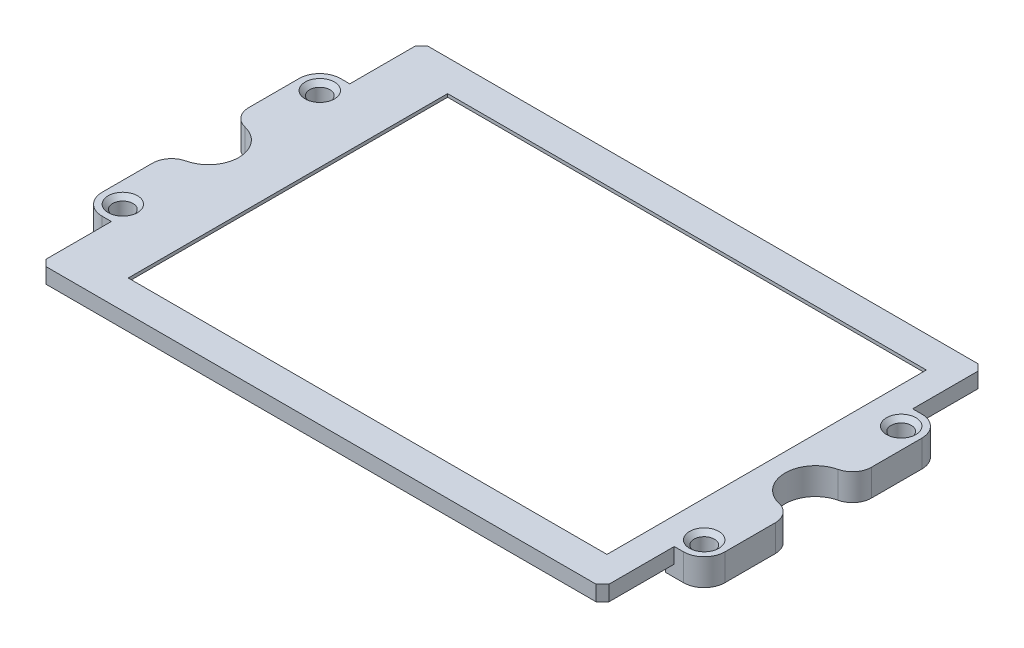
from build123d import *

# Parameters (mm, degrees)
CROQUIS1_R              = 1.6
SALIENTE_EXTRUIR1_DEPTH = 4.5
SALIENTE_EXTRUIR2_DEPTH = 2.7
CORTAR_EXTRUIR1_DEPTH   = 65.504030882
REDONDEO1_R             = 3
CHAFL_N1_SIZE           = 1
CROQUIS6_W              = 1.15
CROQUIS6_H              = 6.95
CORTAR_EXTRUIR3_DEPTH   = 105.891432104
REDONDEO4_R             = 2
REDONDEO5_R             = 2
CROQUIS7_R              = 1.6
CORTAR_EXTRUIR4_DEPTH   = 105.891432104
CHAFL_N2_SIZE           = 1
CROQUIS8_W              = 75.1
CROQUIS8_H              = 50.1
SALIENTE_EXTRUIR4_DEPTH = 0.8
MOVER_START             = 4.2
MOVER_CARA1_OUTLINE_W   = 75.1
MOVER_CARA1_OUTLINE_H   = 50.1
MOVER_CARA1_DEPTH       = 0.3


# Read off the part's stored shape, not the designer's step: Mover cara1
with BuildPart() as part:
    # Croquis1 → Saliente-Extruir1 (new body)
    with BuildSketch(Plane(origin=(0, 0, 0), x_dir=(1, 0, 0), z_dir=(0, 1, 0))):
        with BuildLine():
            Line((-3.25, 30.9), (-3.25, 0))
            ThreePointArc((-3.25, 0), (-2.298097039, -2.298097039), (0, -3.25))
            Line((0, -3.25), (2.8, -3.25))
            Line((2.8, -3.25), (2.8, 7.7))
            Line((2.8, 7.7), (3.8, 7.7))
            Line((3.8, 7.7), (3.8, 23.2))
            Line((3.8, 23.2), (2.8, 23.2))
            Line((2.8, 23.2), (2.8, 34.15))
            Line((2.8, 34.15), (0, 34.15))
            ThreePointArc((0, 34.15), (-2.298097039, 33.198097039), (-3.25, 30.9))
        make_face()
        with Locations(Location((0, 0, 0), (0, 0, 270))):
            Circle(CROQUIS1_R, mode=Mode.SUBTRACT)
        with Locations(Location((0, 30.9, 0), (0, 0, 270))):
            Circle(CROQUIS1_R, mode=Mode.SUBTRACT)
    extrude(amount=SALIENTE_EXTRUIR1_DEPTH)

    # Croquis2 → Saliente-Extruir2 (add)
    with BuildSketch(Plane(origin=(0, 4.5, 0), x_dir=(1, 0, 0), z_dir=(0, 1, 0))):
        Polygon((45.6, -14.5), (1.45, -14.5), (1.45, 45.4), (45.6, 45.4), (45.6, 42.9), (3.95, 42.9), (3.95, -12), (45.6, -12), align=None)
    extrude(amount=-SALIENTE_EXTRUIR2_DEPTH)

    # Croquis3 → Cortar-Extruir1 (cut, through all)
    with BuildSketch(Plane(origin=(0, 4.5, 0), x_dir=(1, 0, 0), z_dir=(0, 1, 0))):
        with BuildLine():
            Line((-2, 10.7), (-3.25, 10.7))
            Line((-3.25, 10.7), (-3.25, 20.2))
            Line((-3.25, 20.2), (-2, 20.2))
            ThreePointArc((-2, 20.2), (2.75, 15.45), (-2, 10.7))
        make_face()
    extrude(amount=-CORTAR_EXTRUIR1_DEPTH, mode=Mode.SUBTRACT)

    # Simetría1: part across plane


with BuildPart() as part_1:
    add(part.part)
    add(part.part.mirror(Plane(origin=(45.6, -74.412582941, 12), x_dir=(0, 0, 1), z_dir=(1, 0, 0))))

    # Redondeo1
    redondeo1_edges = [part_1.edges().sort_by_distance(p)[0] for p in [
        (94.45, 2.25, -20.2),
        (94.45, 2.25, -10.7),
        (-3.25, 2.25, -20.2),
        (-3.25, 2.25, -10.7),
    ]]
    fillet(redondeo1_edges, radius=REDONDEO1_R)

    # Chaflán1
    chafl_n1_edges = [part_1.edges().sort_by_distance(p)[0] for p in [
        (89.75, 3.15, -45.4),
        (89.75, 3.15, 14.5),
        (1.45, 3.15, 14.5),
        (1.45, 3.15, -45.4),
    ]]
    chamfer(chafl_n1_edges, length=CHAFL_N1_SIZE)

    # Croquis6 → Cortar-Extruir3 (cut, through all)
    with BuildSketch(Plane(origin=(0, 4.5, 0), x_dir=(1, 0, 0), z_dir=(0, 1, 0))):
        with Locations((3.375, 2.975)):
            Rectangle(CROQUIS6_W, CROQUIS6_H)
        with Locations((87.825, 27.925)):
            Rectangle(CROQUIS6_W, CROQUIS6_H)
    extrude(amount=-CORTAR_EXTRUIR3_DEPTH, mode=Mode.SUBTRACT)

    # Redondeo4
    # the kernel refuses this fillet: 2 mm, written as the material it adds along each edge
    with BuildSketch(Plane(origin=(88.4, 4.5, -24.45), x_dir=(0, 0, -1), z_dir=(0, -1, 0)), Plane(origin=(2.8, 4.5, -6.45), x_dir=(0, 0, 1), z_dir=(0, -1, 0))) as redondeo4_piece_1:
        with BuildLine():
            CenterArc((1.810386699, -2), REDONDEO4_R, 90, 64.849336587)
            Line((0, -1.15), (-0.036207734, -1.133))
            ThreePointArc((-0.036207734, -1.133), (-0.04, -0.575), (-0.04, 0))
            Line((-0.04, 0), (0, 0.04))
            Line((0, 0.04), (1.810386699, 0.04))
            Line((1.810386699, 0.04), (1.810386699, 0))
        make_face()
    extrude(amount=2.7)
    with BuildSketch(Plane(origin=(88.4, 4.5, -31.4), x_dir=(-1, 0, 0), z_dir=(0, -1, 0)), Plane(origin=(2.8, 4.5, 0.5), x_dir=(1, 0, 0), z_dir=(0, -1, 0))) as redondeo4_piece_2:
        with BuildLine():
            CenterArc((2, -1.810386699), REDONDEO4_R, 115.150663413, 64.849336587)
            Line((0, -1.810386699), (-0.04, -1.810386699))
            Line((-0.04, -1.810386699), (-0.04, 0))
            Line((-0.04, 0), (0, 0.04))
            ThreePointArc((0, 0.04), (0.575, 0.04), (1.133, 0.036207734))
            Line((1.133, 0.036207734), (1.15, 0))
        make_face()
    extrude(amount=2.7)

    # Redondeo5
    redondeo5_edges = [part_1.edges().sort_by_distance(p)[0] for p in [
        (3.95, 3.15, 0.5),
        (3.95, 3.15, -6.45),
        (87.25, 3.15, -31.4),
        (87.25, 3.15, -24.45),
    ]]
    fillet(redondeo5_edges, radius=REDONDEO5_R)

    # Croquis7 → Cortar-Extruir4 (cut, through all)
    with BuildSketch(Plane.XZ):
        with Locations(Location((0, -30.9, 0), (0, 0, 90))):
            Circle(CROQUIS7_R)
        with Locations(Location((0, 0, 0), (0, 0, 90))):
            Circle(CROQUIS7_R)
        with Locations(Location((91.2, -30.9, 0), (0, 0, 90))):
            Circle(CROQUIS7_R)
        with Locations(Location((91.2, 0, 0), (0, 0, 90))):
            Circle(CROQUIS7_R)
    extrude(amount=-CORTAR_EXTRUIR4_DEPTH, mode=Mode.SUBTRACT)

    # Chaflán2
    chafl_n2_edges = [part_1.edges().sort_by_distance(p)[0] for p in [
        (91.2, 4.5, -32.5),
        (91.2, 4.5, -1.6),
        (0, 4.5, -32.5),
        (0, 4.5, -1.6),
    ]]
    chamfer(chafl_n2_edges, length=CHAFL_N2_SIZE)

    # Croquis8 → Saliente-Extruir4 (add)
    with BuildSketch(Plane(origin=(0, 4.5, 0), x_dir=(1, 0, 0), z_dir=(0, 1, 0))):
        with BuildLine():
            Line((3.95, 42.9), (87.25, 42.9))
            Line((87.25, 42.9), (87.25, 32.396301741))
            ThreePointArc((87.25, 32.396301741), (87.399324448, 31.638014197), (87.825, 30.992957521))
            ThreePointArc((87.825, 30.992957521), (88.250675552, 30.347900845), (88.4, 29.589613301))
            Line((88.4, 29.589613301), (88.4, 26.260386699))
            ThreePointArc((88.4, 26.260386699), (88.250675552, 25.502099155), (87.825, 24.857042479))
            ThreePointArc((87.825, 24.857042479), (87.399324448, 24.211985803), (87.25, 23.453698259))
            Line((87.25, 23.453698259), (87.25, -12))
            Line((87.25, -12), (3.95, -12))
            Line((3.95, -12), (3.95, -1.496301741))
            ThreePointArc((3.95, -1.496301741), (3.800675552, -0.738014197), (3.375, -0.092957521))
            ThreePointArc((3.375, -0.092957521), (2.949324448, 0.552099155), (2.8, 1.310386699))
            Line((2.8, 1.310386699), (2.8, 4.639613301))
            ThreePointArc((2.8, 4.639613301), (2.949324448, 5.397900845), (3.375, 6.042957521))
            ThreePointArc((3.375, 6.042957521), (3.800675552, 6.688014197), (3.95, 7.446301741))
            Line((3.95, 7.446301741), (3.95, 42.9))
        make_face()
        with Locations((48, 15.45)):
            Rectangle(CROQUIS8_W, CROQUIS8_H, mode=Mode.SUBTRACT)
    extrude(amount=-SALIENTE_EXTRUIR4_DEPTH)

    # Mover cara1 outline → Mover cara1 (cut)
    with BuildSketch(Plane(origin=(0, 0, 0), x_dir=(1, 0, 0), z_dir=(0, 1, 0)).offset(MOVER_START)):
        with BuildLine():
            Line((0, -3.25), (1.45, -3.25))
            Line((1.45, -3.25), (1.45, -13.5))
            Line((1.45, -13.5), (2.45, -14.5))
            Line((2.45, -14.5), (88.75, -14.5))
            Line((88.75, -14.5), (89.75, -13.5))
            Line((89.75, -13.5), (89.75, -3.25))
            Line((89.75, -3.25), (91.2, -3.25))
            ThreePointArc((91.2, -3.25), (93.498097039, -2.298097039), (94.45, 0))
            Line((94.45, 0), (94.45, 7.900165565))
            ThreePointArc((94.45, 7.900165565), (93.798644084, 9.766678615), (92.127419355, 10.82268212))
            ThreePointArc((92.127419355, 10.82268212), (88.45, 15.45), (92.127419355, 20.07731788))
            ThreePointArc((92.127419355, 20.07731788), (93.798644084, 21.133321385), (94.45, 22.999834435))
            Line((94.45, 22.999834435), (94.45, 30.9))
            ThreePointArc((94.45, 30.9), (93.498097039, 33.198097039), (91.2, 34.15))
            Line((91.2, 34.15), (89.75, 34.15))
            Line((89.75, 34.15), (89.75, 44.4))
            Line((89.75, 44.4), (88.75, 45.4))
            Line((88.75, 45.4), (2.45, 45.4))
            Line((2.45, 45.4), (1.45, 44.4))
            Line((1.45, 44.4), (1.45, 34.15))
            Line((1.45, 34.15), (0, 34.15))
            ThreePointArc((0, 34.15), (-2.298097039, 33.198097039), (-3.25, 30.9))
            Line((-3.25, 30.9), (-3.25, 22.999834435))
            ThreePointArc((-3.25, 22.999834435), (-2.598644084, 21.133321385), (-0.927419355, 20.07731788))
            ThreePointArc((-0.927419355, 20.07731788), (2.75, 15.45), (-0.927419355, 10.82268212))
            ThreePointArc((-0.927419355, 10.82268212), (-2.598644084, 9.766678615), (-3.25, 7.900165565))
            Line((-3.25, 7.900165565), (-3.25, 0))
            ThreePointArc((-3.25, 0), (-2.298097039, -2.298097039), (0, -3.25))
        make_face()
        with Locations((48, 15.45)):
            Rectangle(MOVER_CARA1_OUTLINE_W, MOVER_CARA1_OUTLINE_H, mode=Mode.SUBTRACT)
    extrude(amount=MOVER_CARA1_DEPTH, mode=Mode.SUBTRACT)


solid = part_1.part
